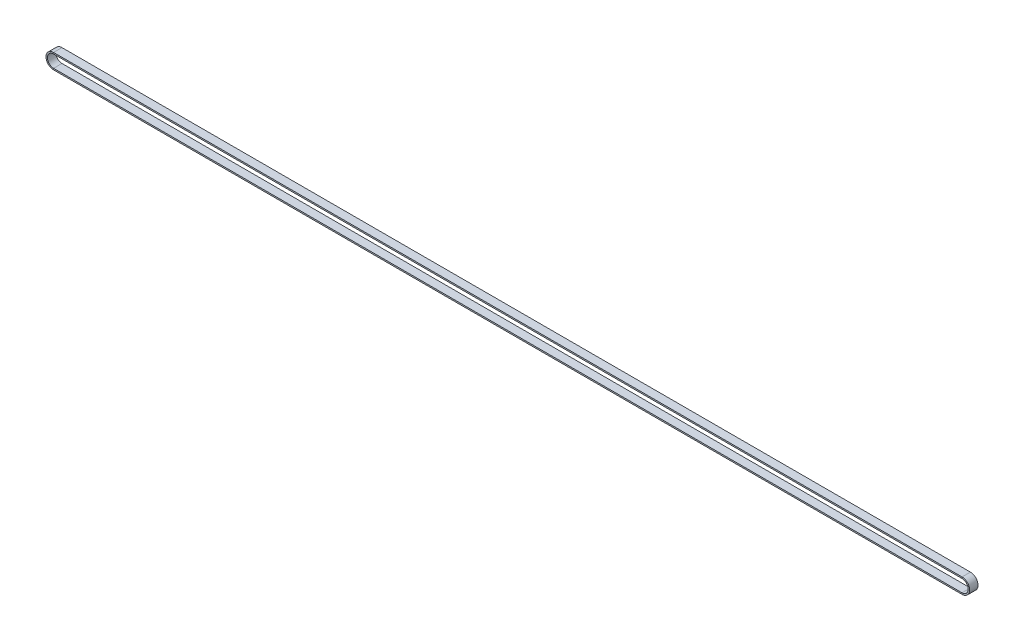
from build123d import *

# Parameters (mm, degrees)
SKETCH3_W = 9
SKETCH3_H = 1.5


with BuildPart() as part:
    # Sweep1: sweep along a path in Sketch2
    with BuildLine(Plane.XY) as sweep1_path:
        Line((-0.000133653, 48.472455955), (-976.331033952, 48.472455955))
        ThreePointArc((-976.331033952, 48.472455955), (-984.470783952, 56.612205955), (-976.331033952, 64.751955955))
        Line((-976.331033952, 64.751955955), (-0.000133653, 64.751955955))
        ThreePointArc((-0.000133653, 64.751955955), (8.139616347, 56.612205955), (-0.000133653, 48.472455955))
    # Sketch3 → Sweep1 (sweep)
    with BuildSketch(Plane(origin=(-0.000133653, 64.751955955, 0), x_dir=(0, 0, -1), z_dir=(1, 0, 0))):
        with Locations((4.5, -0.75)):
            Rectangle(SKETCH3_W, SKETCH3_H)
    sweep(path=sweep1_path.line)


solid = part.part
